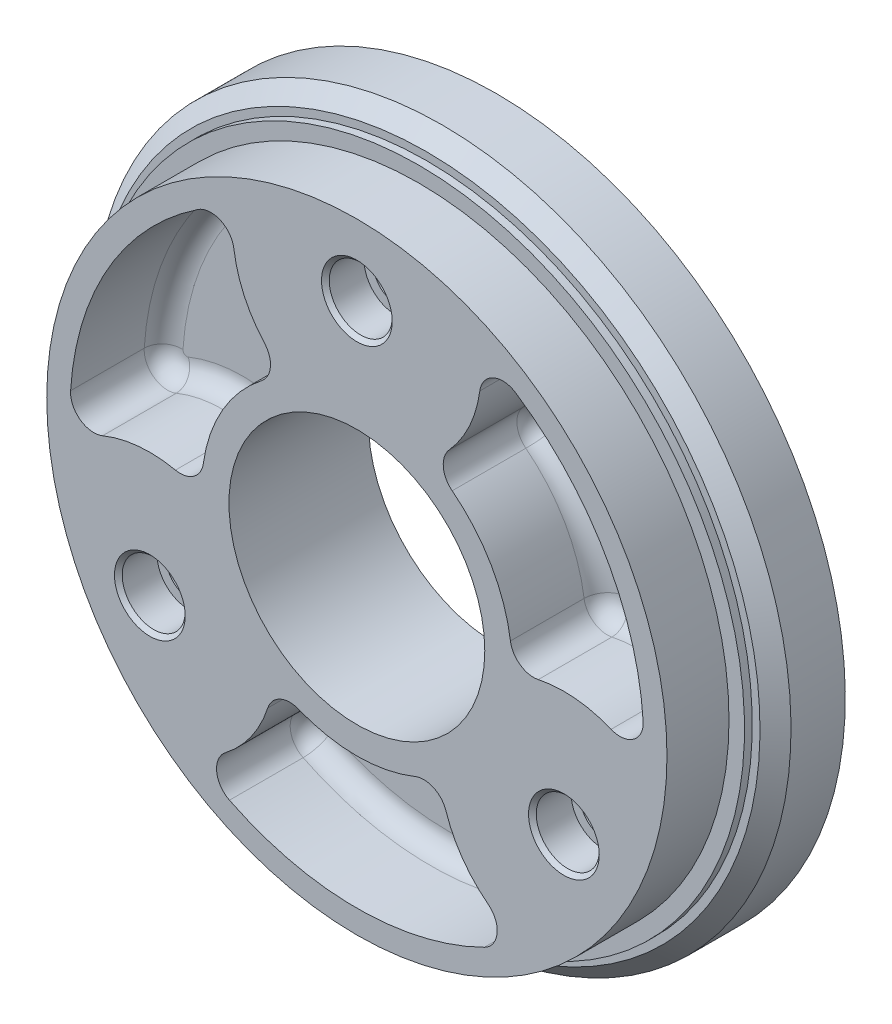
from build123d import *

# Parameters (mm, degrees)
CBORE_FOR_1_4_SOCKET_SHOULDER_SCREW2_D           = 7.14248
CBORE_FOR_1_4_SOCKET_SHOULDER_SCREW2_CBORE_D     = 10.31748
CBORE_FOR_1_4_SOCKET_SHOULDER_SCREW2_CBORE_DEPTH = 6.35
CUT_EXTRUDE1_DEPTH                               = 15.24
SKETCH7_R                                        = 20.955
CUT_EXTRUDE2_DEPTH                               = 84.99300328
CIRPATTERN1_COUNT                                = 3
CHAMFER1_SIZE                                    = 0.635
FILLET1_R                                        = 3.175
SKETCH8_R                                        = 14.2875
SKETCH8_R_2                                      = 3.57124
CUT_EXTRUDE3_DEPTH                               = 7.9375
SKETCH9_R                                        = 11.58875
CUT_EXTRUDE4_DEPTH                               = 1.27
CHAMFER2_SIZE                                    = 2.54


with BuildPart() as part:
    # Sketch2 → Revolve1 (revolve)
    with BuildSketch(Plane(origin=(0, 0, 0), x_dir=(0, 0, -1), z_dir=(1, 0, 0))):
        Polygon((0, 0), (0, 50.8), (10.16, 50.8), (10.16, 53.34), (11.43, 53.34), (11.43, 57.15), (22.86, 57.15), (22.86, 0), align=None)
    revolve(axis=Axis((0, 0, -22.86), (0, 0, 1)))

    # CBORE for 1/4 Socket Shoulder Screw2 (through all)
    with Locations(Plane.XY):
        with Locations((0, 39.158333333)):
            cbore_for_1_4_socket_shoulder_screw2 = CounterBoreHole(CBORE_FOR_1_4_SOCKET_SHOULDER_SCREW2_D / 2, CBORE_FOR_1_4_SOCKET_SHOULDER_SCREW2_CBORE_D / 2, CBORE_FOR_1_4_SOCKET_SHOULDER_SCREW2_CBORE_DEPTH)

    # Sketch5 → Cut-Extrude1 (cut)
    with BuildSketch(Plane.XY):
        with BuildLine():
            ThreePointArc((26.026245142, 39.124093137), (40.694533724, 23.495), (46.895581128, 2.977342889))
            ThreePointArc((46.895581128, 2.977342889), (45.312989605, -0.360641579), (41.643585353, -0.787500666))
            ThreePointArc((41.643585353, -0.787500666), (35.762507979, 0.656406778), (29.717087578, 0.303091123))
            ThreePointArc((29.717087578, 0.303091123), (26.741015075, 0.912975726), (25.156974438, 3.505229964))
            ThreePointArc((25.156974438, 3.505229964), (21.997045256, 12.7), (15.614105414, 20.033963964))
            ThreePointArc((15.614105414, 20.033963964), (14.16116771, 22.701910515), (15.121028401, 25.584207207))
            ThreePointArc((15.121028401, 25.584207207), (18.449718935, 30.643037024), (20.139797094, 36.458153153))
            ThreePointArc((20.139797094, 36.458153153), (22.344170033, 39.422520909), (26.026245142, 39.124093137))
        make_face()
        with BuildLine():
            ThreePointArc((20.869335986, -42.101436027), (0, -46.99), (-20.869335986, -42.101436027))
            ThreePointArc((-20.869335986, -42.101436027), (-22.968819572, -39.061879329), (-21.503788259, -35.670652487))
            ThreePointArc((-21.503788259, -35.670652487), (-17.312789045, -31.299443802), (-14.596059176, -25.88729833))
            ThreePointArc((-14.596059176, -25.88729833), (-12.579847365, -23.614886241), (-9.542869024, -23.539193928))
            ThreePointArc((-9.542869024, -23.539193928), (0, -25.4), (9.542869024, -23.539193928))
            ThreePointArc((9.542869024, -23.539193928), (12.579847365, -23.614886241), (14.596059176, -25.88729833))
            ThreePointArc((14.596059176, -25.88729833), (17.312789045, -31.299443802), (21.503788259, -35.670652487))
            ThreePointArc((21.503788259, -35.670652487), (22.968819572, -39.061879329), (20.869335986, -42.101436027))
        make_face()
        with BuildLine():
            ThreePointArc((-46.895581128, 2.977342889), (-40.694533724, 23.495), (-26.026245142, 39.124093137))
            ThreePointArc((-26.026245142, 39.124093137), (-22.344170033, 39.422520909), (-20.139797094, 36.458153153))
            ThreePointArc((-20.139797094, 36.458153153), (-18.449718935, 30.643037024), (-15.121028401, 25.584207207))
            ThreePointArc((-15.121028401, 25.584207207), (-14.16116771, 22.701910515), (-15.614105414, 20.033963964))
            ThreePointArc((-15.614105414, 20.033963964), (-21.997045256, 12.7), (-25.156974438, 3.505229964))
            ThreePointArc((-25.156974438, 3.505229964), (-26.741015075, 0.912975726), (-29.717087578, 0.303091123))
            ThreePointArc((-29.717087578, 0.303091123), (-35.762507979, 0.656406778), (-41.643585353, -0.787500666))
            ThreePointArc((-41.643585353, -0.787500666), (-45.312989605, -0.360641579), (-46.895581128, 2.977342889))
        make_face()
    extrude(amount=-CUT_EXTRUDE1_DEPTH, mode=Mode.SUBTRACT)

    # Sketch7 → Cut-Extrude2 (cut, through all)
    with BuildSketch(Plane.XY):
        Circle(SKETCH7_R)
    extrude(amount=-CUT_EXTRUDE2_DEPTH, mode=Mode.SUBTRACT)

    # CirPattern1: CBORE for 1/4 Socket Shoulder Screw2 ×3 about axis
    cirpattern1_axis = Axis((0, 0, -22.86), (0, 0, -1))
    for i in range(1, CIRPATTERN1_COUNT):
        add(cbore_for_1_4_socket_shoulder_screw2.rotate(cirpattern1_axis, i * 360 / CIRPATTERN1_COUNT), mode=Mode.SUBTRACT)

    # Chamfer1
    chamfer1_edges = [part.edges().sort_by_distance(p)[0] for p in [
        (-31.332741436, -24.046766558, 0),
        (36.491481436, -15.111566775, 0),
        (-5.15874, 39.158333333, 0),
    ]]
    chamfer(chamfer1_edges, length=CHAMFER1_SIZE)

    # Fillet1
    fillet1_edges = [part.edges().sort_by_distance(p)[0] for p in [
        (12.579847365, -23.614886241, -15.24),
        (17.312789045, -31.299443802, -15.24),
        (22.968819572, -39.061879329, -15.24),
        (0, -46.99, -15.24),
        (-22.968819572, -39.061879329, -15.24),
        (-17.312789045, -31.299443802, -15.24),
        (-12.579847365, -23.614886241, -15.24),
        (0, -25.4, -15.24),
        (-26.741015075, 0.912975726, -15.24),
        (-35.762507979, 0.656406778, -15.24),
        (-45.312989605, -0.360641579, -15.24),
        (-40.694533724, 23.495, -15.24),
        (-22.344170033, 39.422520909, -15.24),
        (-18.449718935, 30.643037024, -15.24),
        (-14.16116771, 22.701910515, -15.24),
        (-21.997045256, 12.7, -15.24),
        (18.449718935, 30.643037024, -15.24),
        (22.344170033, 39.422520909, -15.24),
        (40.694533724, 23.495, -15.24),
        (45.312989605, -0.360641579, -15.24),
        (35.762507979, 0.656406778, -15.24),
        (26.741015075, 0.912975726, -15.24),
        (21.997045256, 12.7, -15.24),
        (14.16116771, 22.701910515, -15.24),
    ]]
    fillet(fillet1_edges, radius=FILLET1_R)

    # Sketch8 → Cut-Extrude3 (cut)
    # profile 1 of 3: a face of its own
    with BuildSketch(Plane(origin=(0, 0, -22.86), x_dir=(-1, 0, 0), z_dir=(0, 0, -1))):
        with Locations((0, 39.158333333)):
            Circle(SKETCH8_R)
        with Locations((0, 39.158333333)):
            Circle(SKETCH8_R_2, mode=Mode.SUBTRACT)
    # profile 2 of 3: a face of its own
    with BuildSketch(Plane(origin=(0, 0, -22.86), x_dir=(-1, 0, 0), z_dir=(0, 0, -1))):
        with Locations((33.912111437, -19.579166667)):
            Circle(SKETCH8_R)
    # profile 3 of 3: a face of its own
    with BuildSketch(Plane(origin=(0, 0, -22.86), x_dir=(-1, 0, 0), z_dir=(0, 0, -1))):
        with Locations((-33.912111437, -19.579166667)):
            Circle(SKETCH8_R)
    extrude(amount=-CUT_EXTRUDE3_DEPTH, mode=Mode.SUBTRACT)

    # Sketch9 → Cut-Extrude4 (cut)
    with BuildSketch(Plane(origin=(0, 0, -14.9225), x_dir=(-1, 0, 0), z_dir=(0, 0, -1))):
        with Locations((0, 39.158333333)):
            Circle(SKETCH9_R)
        with Locations((33.912111437, -19.579166667)):
            Circle(SKETCH9_R)
        with Locations((-33.912111437, -19.579166667)):
            Circle(SKETCH9_R)
    extrude(amount=-CUT_EXTRUDE4_DEPTH, mode=Mode.SUBTRACT)

    # Chamfer2
    chamfer2_edges = [part.edges().sort_by_distance(p)[0] for p in [
        (0, -57.15, -11.43),
    ]]
    chamfer(chamfer2_edges, length=CHAMFER2_SIZE)


solid = part.part
